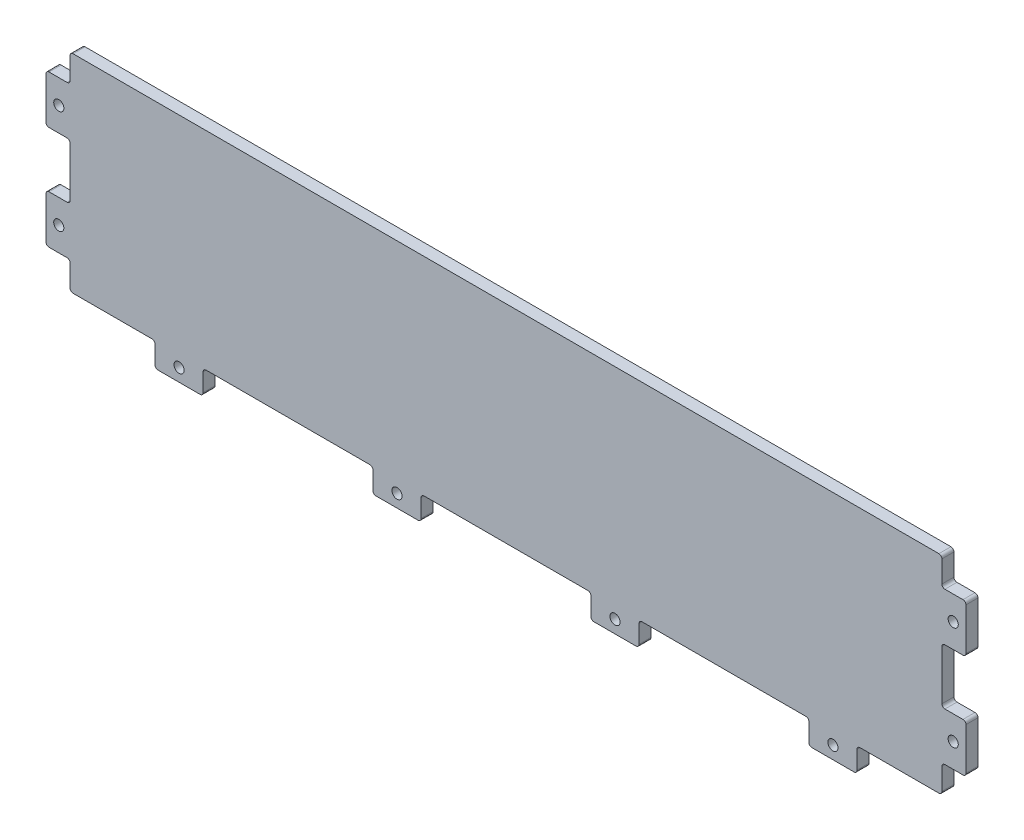
from build123d import *

# Parameters (mm, degrees)
BOSS_EXTRUDE1_DEPTH  = 6.35
TABS_DEPTH           = 6.35
FILLET1_R            = 3.175
SKETCH3_R            = 5.3578125
CABLE_TIE_HOLE_DEPTH = 505.208093976


with BuildPart() as part:
    # Sketch1 → Boss-Extrude1 (new, symmetric)
    with BuildSketch(Plane.XY):
        with BuildLine():
            Line((-457.2, -109.5375), (457.2, -109.5375))
            ThreePointArc((457.2, -109.5375), (459.44506403, -108.60756403), (460.375, -106.3625))
            Line((460.375, -106.3625), (460.375, 106.3625))
            ThreePointArc((460.375, 106.3625), (459.44506403, 108.60756403), (457.2, 109.5375))
            Line((457.2, 109.5375), (-457.2, 109.5375))
            ThreePointArc((-457.2, 109.5375), (-459.44506403, 108.60756403), (-460.375, 106.3625))
            Line((-460.375, 106.3625), (-460.375, -106.3625))
            ThreePointArc((-460.375, -106.3625), (-459.44506403, -108.60756403), (-457.2, -109.5375))
        make_face()
    extrude(amount=BOSS_EXTRUDE1_DEPTH, both=True)

    # Sketch2 → Tabs (add, symmetric)
    with BuildSketch(Plane.XY):
        with BuildLine():
            Line((-460.375, 80.16875), (-482.6, 80.16875))
            ThreePointArc((-482.6, 80.16875), (-484.84506403, 79.23881403), (-485.775, 76.99375))
            Line((-485.775, 76.99375), (-485.775, 32.54375))
            ThreePointArc((-485.775, 32.54375), (-484.84506403, 30.29868597), (-482.6, 29.36875))
            Line((-482.6, 29.36875), (-460.375, 29.36875))
            Line((-460.375, 29.36875), (-460.375, 80.16875))
        make_face()
        with BuildLine():
            Line((-460.375, -29.36875), (-482.6, -29.36875))
            ThreePointArc((-482.6, -29.36875), (-484.84506403, -30.29868597), (-485.775, -32.54375))
            Line((-485.775, -32.54375), (-485.775, -76.99375))
            ThreePointArc((-485.775, -76.99375), (-484.84506403, -79.23881403), (-482.6, -80.16875))
            Line((-482.6, -80.16875), (-460.375, -80.16875))
            Line((-460.375, -80.16875), (-460.375, -29.36875))
        make_face()
        with BuildLine():
            Line((-370.68125, -109.5375), (-370.68125, -131.7625))
            ThreePointArc((-370.68125, -131.7625), (-369.75131403, -134.00756403), (-367.50625, -134.9375))
            Line((-367.50625, -134.9375), (-323.05625, -134.9375))
            ThreePointArc((-323.05625, -134.9375), (-320.81118597, -134.00756403), (-319.88125, -131.7625))
            Line((-319.88125, -131.7625), (-319.88125, -109.5375))
            Line((-319.88125, -109.5375), (-370.68125, -109.5375))
        make_face()
        with BuildLine():
            Line((-140.49375, -109.5375), (-140.49375, -131.7625))
            ThreePointArc((-140.49375, -131.7625), (-139.56381403, -134.00756403), (-137.31875, -134.9375))
            Line((-137.31875, -134.9375), (-92.86875, -134.9375))
            ThreePointArc((-92.86875, -134.9375), (-90.62368597, -134.00756403), (-89.69375, -131.7625))
            Line((-89.69375, -131.7625), (-89.69375, -109.5375))
            Line((-89.69375, -109.5375), (-140.49375, -109.5375))
        make_face()
    tabs = extrude(amount=TABS_DEPTH, both=True)

    # Mirror1: Tabs across plane
    add(tabs.mirror(Plane(origin=(0, 0, 0), x_dir=(0, 0, 1), z_dir=(1, 0, 0))))

    # Fillet1
    fillet1_edges = [part.edges().sort_by_distance(p)[0] for p in [
        (-89.69375, -109.5375, 0),
        (-140.49375, -109.5375, 0),
        (-319.88125, -109.5375, 0),
        (-370.68125, -109.5375, 0),
        (-460.375, -80.16875, 0),
        (-460.375, -29.36875, 0),
        (-460.375, 29.36875, 0),
        (-460.375, 80.16875, 0),
        (460.375, 29.36875, 0),
        (460.375, 80.16875, 0),
        (460.375, -29.36875, 0),
        (460.375, -80.16875, 0),
        (319.88125, -109.5375, 0),
        (89.69375, -109.5375, 0),
        (370.68125, -109.5375, 0),
        (140.49375, -109.5375, 0),
    ]]
    fillet(fillet1_edges, radius=FILLET1_R)

    # Sketch3 → Cable Tie hole (cut, symmetric)
    with BuildSketch(Plane.XY):
        with Locations((-472.28125, 54.76875)):
            Circle(SKETCH3_R)
        with Locations((-472.28125, -54.76875)):
            Circle(SKETCH3_R)
        with Locations((-345.28125, -121.44375)):
            Circle(SKETCH3_R)
        with Locations((-115.09375, -121.44375)):
            Circle(SKETCH3_R)
    cable_tie_hole = extrude(amount=CABLE_TIE_HOLE_DEPTH, both=True, mode=Mode.SUBTRACT)

    # Mirror2: Cable Tie hole across plane
    add(cable_tie_hole.mirror(Plane(origin=(0, 0, 0), x_dir=(0, 0, 1), z_dir=(1, 0, 0))), mode=Mode.SUBTRACT)


solid = part.part
